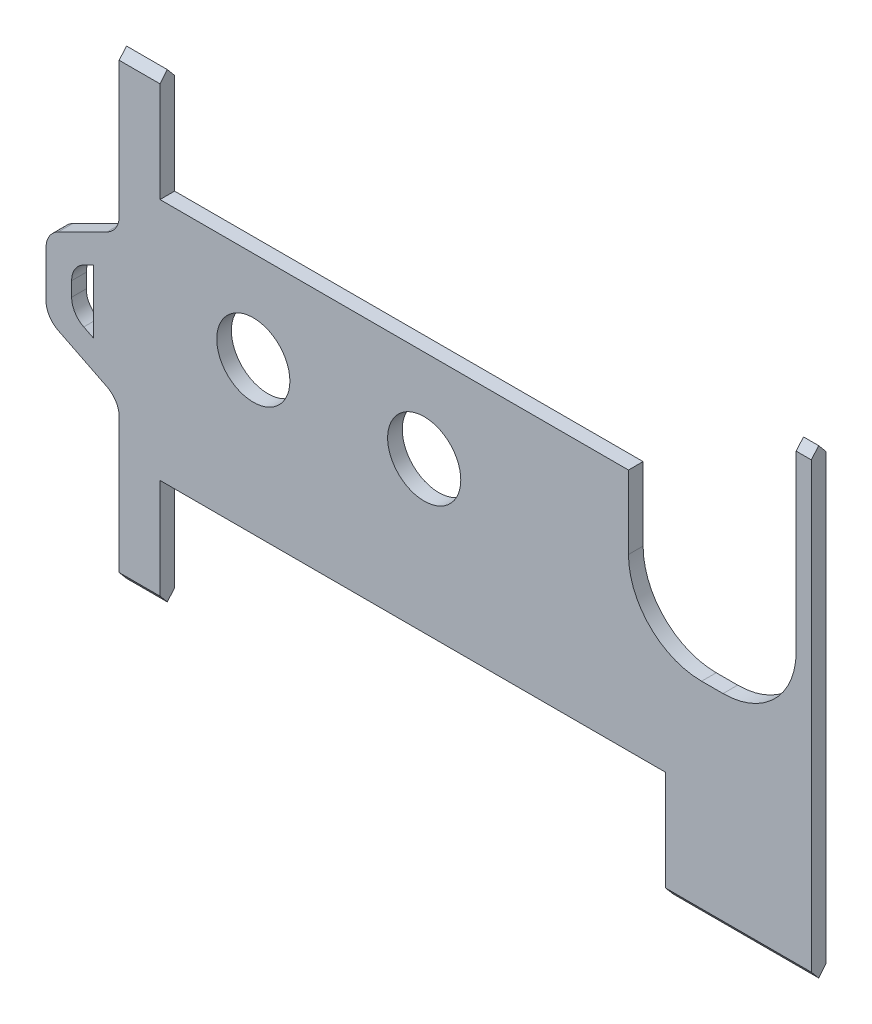
from build123d import *

# Parameters (mm, degrees)
SKETCH1_R           = 5
BOSS_EXTRUDE1_DEPTH = 1
CUT_EXTRUDE1_DEPTH  = 161.061343452
FILLET1_R           = 10
FILLET2_R           = 3


with BuildPart() as part:
    # Sketch1 → Boss-Extrude1 (new, symmetric)
    with BuildSketch(Plane.XY.offset(11.1483132)):
        Polygon((12.423, 91.8975), (22.423, 86.8975), (22.423, 65.272), (28.004997253, 65.272), (28.004997253, 80.272), (97.123000954, 80.272), (97.123000954, 65.272), (117.048, 65.272), (117.048, 128.523), (114.975658012, 128.523), (114.975658012, 93.523), (92.048, 93.523), (92.048, 113.523), (28.004997253, 113.523), (28.004997253, 128.523), (22.423, 128.523), (22.423, 106.8975), (12.423, 101.8975), align=None)
        Polygon((18.923, 92.560618961), (15.923, 94.060618961), (15.923, 99.734381039), (18.923, 101.234381039), align=None, mode=Mode.SUBTRACT)
        with Locations((64.123001099, 100.880996704)):
            Circle(SKETCH1_R, mode=Mode.SUBTRACT)
        with Locations((40.758998871, 100.90599823)):
            Circle(SKETCH1_R, mode=Mode.SUBTRACT)
    extrude(amount=BOSS_EXTRUDE1_DEPTH, both=True)

    # Sketch2 → Cut-Extrude1 (cut, through all)
    with BuildSketch(Plane.ZY.offset(-22.423)):
        Polygon((10.101339955, 128.523), (10.101339955, 127.168225732), (11.1483132, 128.412378938), (12.195286445, 127.168225732), (12.195286445, 128.523), align=None)
        Polygon((12.195286445, 66.626774268), (12.195286445, 65.272), (10.101339955, 65.272), (10.101339955, 66.626774268), (11.1483132, 65.382621062), align=None)
    extrude(amount=-CUT_EXTRUDE1_DEPTH, mode=Mode.SUBTRACT)

    # Fillet1
    fillet1_edges = [part.edges().sort_by_distance(p)[0] for p in [
        (92.048, 93.523, 11.1483132),
        (114.975658012, 93.523, 11.1483132),
    ]]
    fillet(fillet1_edges, radius=FILLET1_R)

    # Fillet2
    fillet2_edges = [part.edges().sort_by_distance(p)[0] for p in [
        (15.923, 99.734381039, 11.1483132),
        (15.923, 94.060618961, 11.1483132),
        (22.423, 106.8975, 11.1483132),
        (12.423, 101.8975, 11.1483132),
        (12.423, 91.8975, 11.1483132),
        (22.423, 86.8975, 11.1483132),
    ]]
    fillet(fillet2_edges, radius=FILLET2_R)


solid = part.part
